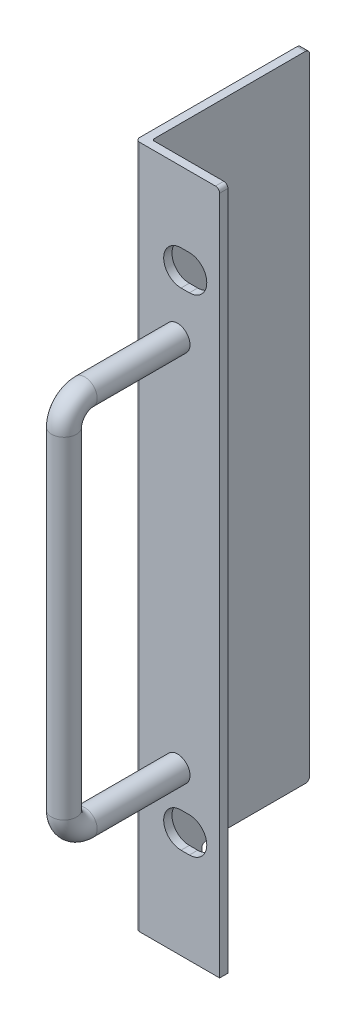
from build123d import *

# Parameters (mm, degrees)
BOSS_EXTRUDE1_DEPTH = 165
CUT_EXTRUDE1_DEPTH  = 132
SKETCH5_R           = 3
SKETCH6_W           = 26
SKETCH6_H           = 12
CUT_EXTRUDE2_DEPTH  = 132
FILLET1_R           = 1
FILLET2_R           = 0.5


with BuildPart() as part:
    # Sketch1 → Boss-Extrude1 (new body)
    with BuildSketch(Plane(origin=(0, 0, 0), x_dir=(1, 0, 0), z_dir=(0, 1, 0))):
        Polygon((0, 0), (0, 40), (2, 40), (2, 2), (20.3, 2), (20.3, 0), align=None)
    extrude(amount=BOSS_EXTRUDE1_DEPTH)

    # Sketch2 → Cut-Extrude1 (cut)
    with BuildSketch(Plane.XY):
        with BuildLine():
            Line((13, 139.545), (11, 139.545))
            ThreePointArc((11, 139.545), (6.8, 143.745), (11, 147.945))
            Line((11, 147.945), (13, 147.945))
            ThreePointArc((13, 147.945), (17.2, 143.745), (13, 139.545))
        make_face()
        with BuildLine():
            Line((13, 30.455), (11, 30.455))
            ThreePointArc((11, 30.455), (6.8, 26.255), (11, 22.055))
            Line((11, 22.055), (13, 22.055))
            ThreePointArc((13, 22.055), (17.2, 26.255), (13, 30.455))
        make_face()
    extrude(amount=-CUT_EXTRUDE1_DEPTH, mode=Mode.SUBTRACT)

    # Sweep1: sweep along a path in Sketch4
    with BuildLine(Plane(origin=(10.15, 0, 0), x_dir=(0, 0, -1), z_dir=(1, 0, 0))) as sweep1_path:
        Line((0, 128.745), (-22.4, 128.745))
        ThreePointArc((-22.4, 128.745), (-25.935533906, 127.280533906), (-27.4, 123.745))
        Line((-27.4, 123.745), (-27.4, 43.745))
        ThreePointArc((-27.4, 43.745), (-25.935533906, 40.209466094), (-22.4, 38.745))
        Line((-22.4, 38.745), (0, 38.745))
    # Sketch5 → Sweep1 (sweep)
    with BuildSketch(Plane.XY):
        with Locations((10.15, 128.745)):
            Circle(SKETCH5_R)
    sweep(path=sweep1_path.line)

    # Sketch6 → Cut-Extrude2 (cut)
    with BuildSketch(Plane(origin=(2, 0, 0), x_dir=(0, 0, -1), z_dir=(1, 0, 0))):
        with Locations((27, 6)):
            Rectangle(SKETCH6_W, SKETCH6_H)
    extrude(amount=-CUT_EXTRUDE2_DEPTH, mode=Mode.SUBTRACT)

    # Fillet1
    fillet1_edges = [part.edges().sort_by_distance(p)[0] for p in [
        (0, 82.5, 0),
        (20.3, 165, -1),
        (1, 165, -40),
        (1, 12, -40),
        (1, 12, -14),
        (1, 0, -14),
    ]]
    fillet(fillet1_edges, radius=FILLET1_R)

    # Fillet2
    fillet2_edges = [part.edges().sort_by_distance(p)[0] for p in [
        (2, 82.5, -2),
    ]]
    fillet(fillet2_edges, radius=FILLET2_R)


solid = part.part
